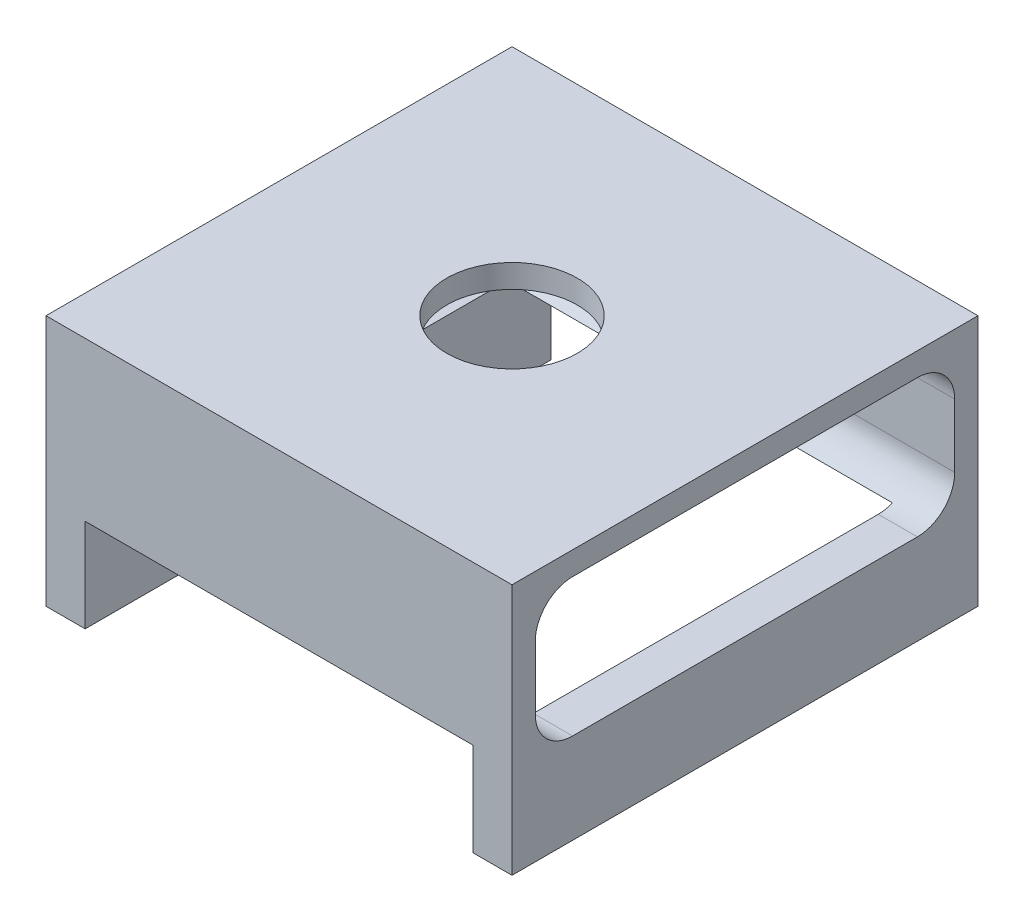
from build123d import *

# Parameters (mm, degrees)
SKETCH1_W           = 31.75
SKETCH1_H           = 31.75
BOSS_EXTRUDE1_DEPTH = 17.145
SKETCH2_R           = 4.445
CUT_EXTRUDE1_DEPTH  = 49.063250254
SKETCH3_W           = 26.416
SKETCH3_H           = 6.35
CUT_EXTRUDE2_DEPTH  = 49.063250254
SKETCH4_W           = 28.575
SKETCH4_H           = 9.398
CUT_EXTRUDE3_DEPTH  = 49.063250254
FILLET2_R           = 2.54


with BuildPart() as part:
    # Sketch1 → Boss-Extrude1 (new body)
    with BuildSketch(Plane(origin=(0, 0, 0), x_dir=(1, 0, 0), z_dir=(0, 1, 0))):
        with Locations((15.875, 15.875)):
            Rectangle(SKETCH1_W, SKETCH1_H)
    extrude(amount=BOSS_EXTRUDE1_DEPTH)

    # Sketch2 → Cut-Extrude1 (cut, through all)
    with BuildSketch(Plane(origin=(0, 17.145, 0), x_dir=(1, 0, 0), z_dir=(0, 1, 0))):
        with Locations((15.875, 15.875)):
            Circle(SKETCH2_R)
    extrude(amount=-CUT_EXTRUDE1_DEPTH, mode=Mode.SUBTRACT)

    # Sketch3 → Cut-Extrude2 (cut, through all)
    with BuildSketch(Plane.XY):
        with Locations((15.875, 3.175)):
            Rectangle(SKETCH3_W, SKETCH3_H)
    extrude(amount=-CUT_EXTRUDE2_DEPTH, mode=Mode.SUBTRACT)

    # Sketch4 → Cut-Extrude3 (cut, through all)
    with BuildSketch(Plane.ZY):
        with Locations((-15.875, 10.8585)):
            Rectangle(SKETCH4_W, SKETCH4_H)
    extrude(amount=-CUT_EXTRUDE3_DEPTH, mode=Mode.SUBTRACT)

    # Fillet2
    fillet2_edges = [part.edges().sort_by_distance(p)[0] for p in [
        (30.4165, 6.1595, -30.1625),
        (1.3335, 6.1595, -1.5875),
        (15.875, 15.5575, -1.5875),
        (15.875, 15.5575, -30.1625),
    ]]
    fillet(fillet2_edges, radius=FILLET2_R)


solid = part.part
